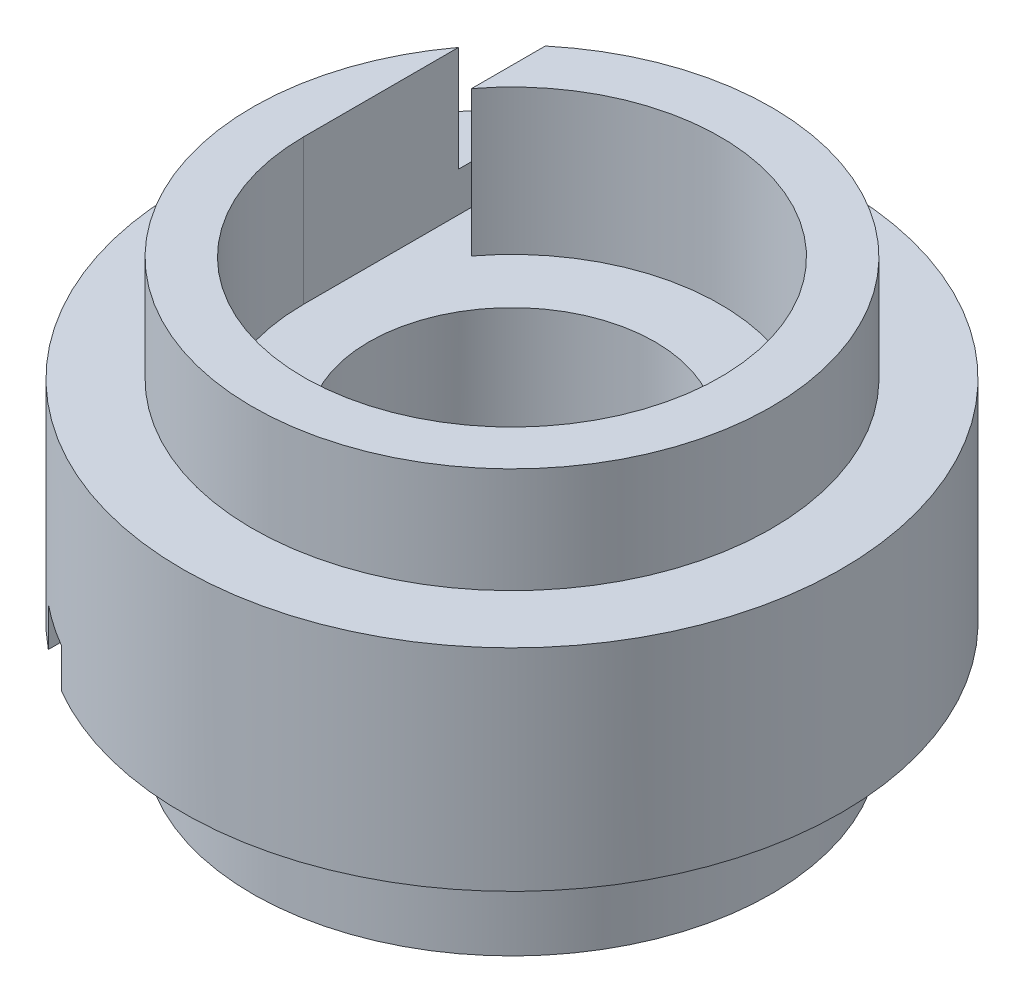
from build123d import *

# Parameters (mm, degrees)
SKETCH1_R           = 31.75
SKETCH1_R_2         = 13.788571429
BOSS_EXTRUDE1_DEPTH = 20.32
CUT_EXTRUDE1_DEPTH  = 13.97
SKETCH13_R          = 31.75
SKETCH13_R_2        = 25
CUT_EXTRUDE2_DEPTH  = 10.16
CIRPATTERN1_COUNT   = 2


with BuildPart() as part:
    # Sketch1 → Boss-Extrude1 (new, symmetric)
    with BuildSketch(Plane(origin=(0, 0, 0), x_dir=(1, 0, 0), z_dir=(0, 1, 0))):
        Circle(SKETCH1_R)
        Circle(SKETCH1_R_2, mode=Mode.SUBTRACT)
    extrude(amount=BOSS_EXTRUDE1_DEPTH, both=True)

    # Sketch2 → Cut-Extrude1 (cut)
    with BuildSketch(Plane(origin=(0, 20.32, 0), x_dir=(1, 0, 0), z_dir=(0, 1, 0))):
        with BuildLine():
            Line((-20.066, 0), (-20.066, 24.60524627))
            ThreePointArc((-20.066, 24.60524627), (-18.088933462, 26.093159759), (-16.002, 27.422590979))
            Line((-16.002, 27.422590979), (-16.002, 12.107037292))
            ThreePointArc((-16.002, 12.107037292), (19.022887373, -6.385460986), (-20.066, 0))
        make_face()
    cut_extrude1 = extrude(amount=-CUT_EXTRUDE1_DEPTH, mode=Mode.SUBTRACT)

    # Sketch13 → Cut-Extrude2 (cut)
    with BuildSketch(Plane(origin=(0, 20.32, 0), x_dir=(1, 0, 0), z_dir=(0, 1, 0))):
        Circle(SKETCH13_R)
        Circle(SKETCH13_R_2, mode=Mode.SUBTRACT)
    cut_extrude2 = extrude(amount=-CUT_EXTRUDE2_DEPTH, mode=Mode.SUBTRACT)

    # CirPattern1: Cut-Extrude1, Cut-Extrude2 ×2 about axis
    cirpattern1_axis = Axis((34.925, 0, 0), (-1, 0, 0))
    add([cut_extrude1.rotate(cirpattern1_axis, i * 360 / CIRPATTERN1_COUNT) for i in range(1, CIRPATTERN1_COUNT)], mode=Mode.SUBTRACT)
    add([cut_extrude2.rotate(cirpattern1_axis, i * 360 / CIRPATTERN1_COUNT) for i in range(1, CIRPATTERN1_COUNT)], mode=Mode.SUBTRACT)


solid = part.part
